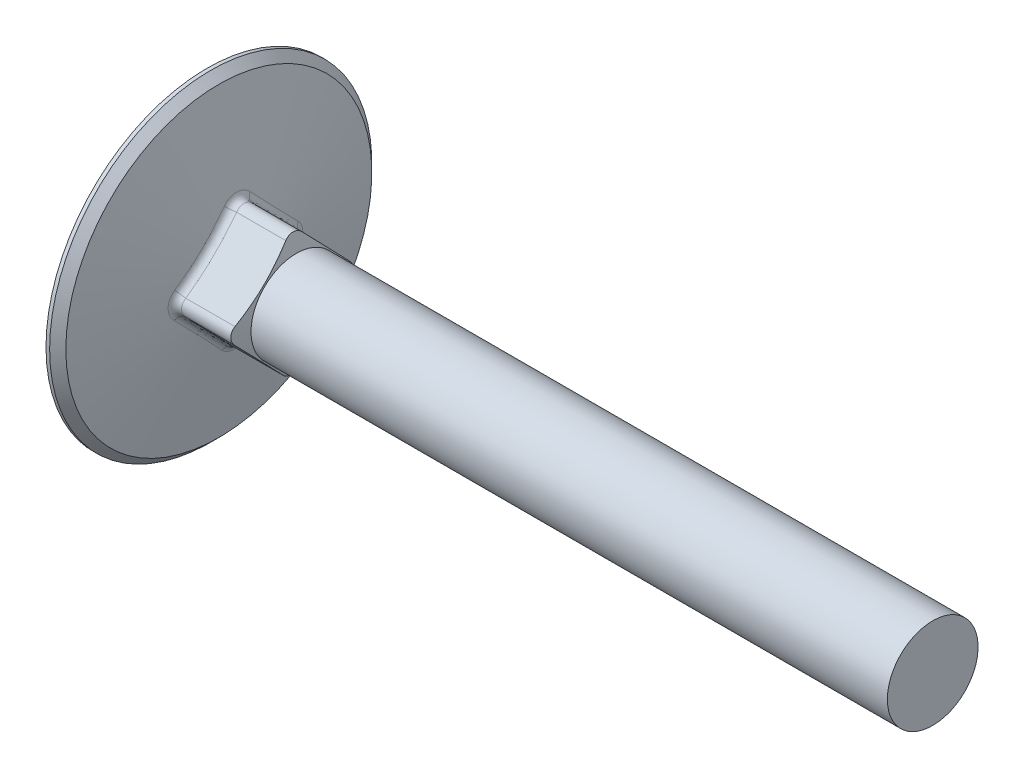
from build123d import *

# Parameters (mm, degrees)
NECK_DEPTH   = 9.3726
HEADFILLET_R = 0.7874


with BuildPart() as part:
    # BodySke → BaseBody (revolve)
    with BuildSketch(Plane.XY):
        Polygon((0, 0), (0, 16.9164), (0.381, 16.9164), (1.231924038, 16.065475962), (3.429, 4.7625), (76.2, 4.7625), (76.2, 0), align=None)
    revolve(axis=Axis((-6.35, 0, 0), (1, 0, 0)))

    # Sketch2 → Neck (add)
    with BuildSketch(Plane(origin=(0, 0, 0), x_dir=(0, 0.6946583704589985, -0.7193398003386501), z_dir=(1, 0, 0))):
        with BuildLine():
            Line((3.7084, -4.9022), (-3.7084, -4.9022))
            ThreePointArc((-3.7084, -4.9022), (-4.552544075, -4.552544075), (-4.9022, -3.7084))
            Line((-4.9022, -3.7084), (-4.9022, 3.7084))
            ThreePointArc((-4.9022, 3.7084), (-4.552544075, 4.552544075), (-3.7084, 4.9022))
            Line((-3.7084, 4.9022), (3.7084, 4.9022))
            ThreePointArc((3.7084, 4.9022), (4.552544075, 4.552544075), (4.9022, 3.7084))
            Line((4.9022, 3.7084), (4.9022, -3.7084))
            ThreePointArc((4.9022, -3.7084), (4.552544075, -4.552544075), (3.7084, -4.9022))
        make_face()
    extrude(amount=NECK_DEPTH)

    # Sketch3 → NeckChamfer (revolve, cut)
    with BuildSketch(Plane.XY):
        Polygon((2.713017566, 29.6164), (9.3726, 4.7625), (9.6266, 4.7625), (9.6266, 29.6164), align=None)
    revolve(axis=Axis((0, 0, 0), (1, 0, 0)), mode=Mode.SUBTRACT)

    # HeadFillet
    headfillet_edges = [part.edges().sort_by_distance(p)[0] for p in [
        (3.103263392, -6.437288995, 0.112363299),
        (3.401845071, -3.405354264, 3.526347569),
        (3.401845071, -3.526347569, -3.405354264),
        (3.103263392, 0.112363299, 6.437288995),
        (3.103263392, -0.112363299, -6.437288995),
        (3.401845071, 3.526347569, 3.405354264),
        (3.401845071, 3.405354264, -3.526347569),
        (3.121431163, 6.332280366, 0.398458833),
    ]]
    fillet(headfillet_edges, radius=HEADFILLET_R)


solid = part.part
